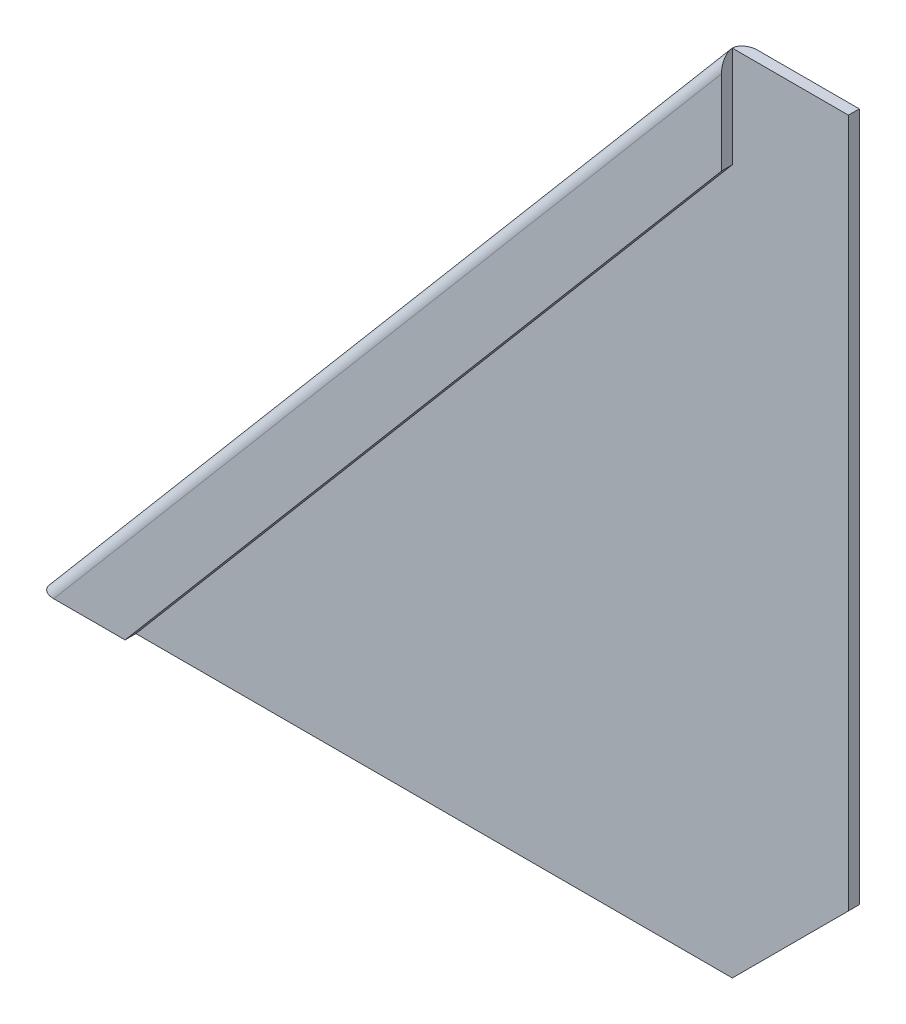
from build123d import *

# Parameters (mm, degrees)
EXTRUDE_1_DEPTH = 1.5
EXTRUDE_2_DEPTH = 3
FILLET_1_R      = 1.5


with BuildPart() as part:
    # 草圖1 → 擠出1 (new body)
    with BuildSketch(Plane.XY):
        Polygon((-16, 0), (0, 16), (0, 111), (-16, 111), (-16, 97.073509127), (-98.206395117, 0), align=None)
    extrude(amount=EXTRUDE_1_DEPTH)

    # 草圖2 → 擠出2 (add)
    with BuildSketch(Plane.XY):
        Polygon((-110, 0), (-98.206395117, 0), (-16, 97.073509127), (-16, 111), align=None)
    extrude(amount=EXTRUDE_2_DEPTH)

    # 圓角1
    fillet_1_edges = [part.edges().sort_by_distance(p)[0] for p in [
        (-63, 55.5, 0),
        (-63, 55.5, 3),
    ]]
    fillet(fillet_1_edges, radius=FILLET_1_R - 0.0001)  # a hair under: the kernel refuses the full size


solid = part.part
